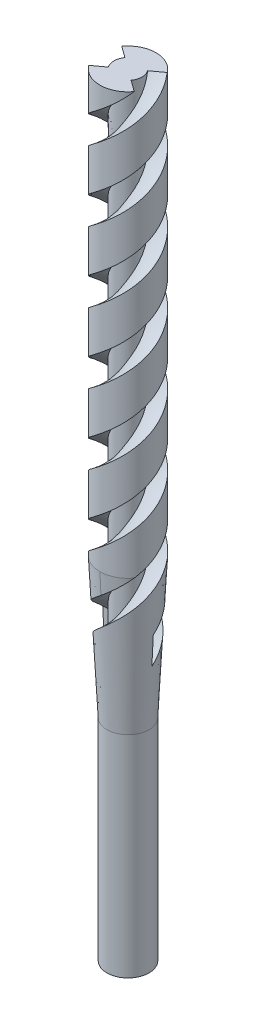
from build123d import *

# Parameters (mm, degrees)
CUT_SWEEP1_PITCH = 20
CUT_SWEEP2_PITCH = 20


with BuildPart() as part:
    # Sketch1 → Revolve1 (revolve)
    with BuildSketch(Plane.XY, mode=Mode.PRIVATE) as revolve1_sk:
        Polygon((0, 332.499538991), (4, 332.499538991), (4, 272.499538991), (3, 252.499538991), (3, 222.499538991), (0, 222.499538991), align=None)
    revolve(revolve1_sk.sketch.rotate(Axis((0, 0, 0), (0, -1, 0)), 90), axis=Axis((0, 0, 0), (0, -1, 0)))

    # Cut-Sweep1: arcs per turn and ends read off the stored shape
    # Cut-Sweep1: the profile of Sketch4 screwed along a right-hand helix through 4.5 turns, 20 arcs to a turn; built about Z, then put on its axis
    cut_sweep1_z = Axis((0, 0, 0), (0, 0, 1))
    cut_sweep1_corners = [(2, 0, -22), (6, 0, -22), (6, 0, -18), (2, 0, -18)]
    with BuildLine(mode=Mode.PRIVATE) as cut_sweep1_profile:
        Line(cut_sweep1_corners[0], cut_sweep1_corners[1])
        Line(cut_sweep1_corners[1], cut_sweep1_corners[2])
        Line(cut_sweep1_corners[2], cut_sweep1_corners[3])
        Line(cut_sweep1_corners[3], cut_sweep1_corners[0])
    cut_sweep1_cap = Face(cut_sweep1_profile.wire())
    cut_sweep1_turn_angles = [0, 9, 18, 27, 36, 45, 54, 63, 72, 81, 90, 99, 108, 117, 126, 135, 144, 153, 162, 171, 180, 189, 198, 207, 216, 225, 234, 243, 252, 261, 270, 279, 288, 297, 306, 315, 324, 333, 342, 351, 360]
    cut_sweep1_turn_weights = [1, 0.9876883405951378, 1, 0.9876883405951378, 1, 0.9876883405951378, 1, 0.9876883405951378, 1, 0.9876883405951378, 1, 0.9876883405951378, 1, 0.9876883405951378, 1, 0.9876883405951378, 1, 0.9876883405951378, 1, 0.9876883405951378, 1, 0.9876883405951378, 1, 0.9876883405951378, 1, 0.9876883405951378, 1, 0.9876883405951378, 1, 0.9876883405951378, 1, 0.9876883405951378, 1, 0.9876883405951378, 1, 0.9876883405951378, 1, 0.9876883405951378, 1, 0.9876883405951378, 1]
    cut_sweep1_turn_rails = [Edge.make_bspline([Vector(p[0], p[1], 0).rotate(cut_sweep1_z, cut_sweep1_turn_angles[k]) / cut_sweep1_turn_weights[k] + Vector(0, 0, p[2] + CUT_SWEEP1_PITCH * cut_sweep1_turn_angles[k] / 360) for k in range(41)], [0, 0, 0, 1, 1, 2, 2, 3, 3, 4, 4, 5, 5, 6, 6, 7, 7, 8, 8, 9, 9, 10, 10, 11, 11, 12, 12, 13, 13, 14, 14, 15, 15, 16, 16, 17, 17, 18, 18, 19, 19, 20, 20, 20], 2, cut_sweep1_turn_weights) for p in cut_sweep1_corners]
    cut_sweep1_turn_sides = [Face.make_surface_from_curves(cut_sweep1_turn_rails[p[0]], cut_sweep1_turn_rails[p[1]]) for p in [(0, 1), (1, 2), (2, 3), (3, 0)]]
    cut_sweep1_last_angles = [1440, 1449, 1458, 1467, 1476, 1485, 1494, 1503, 1512, 1521, 1530, 1539, 1548, 1557, 1566, 1575, 1584, 1593, 1602, 1611, 1620]
    cut_sweep1_last_weights = [1, 0.9876883405951378, 1, 0.9876883405951378, 1, 0.9876883405951378, 1, 0.9876883405951378, 1, 0.9876883405951378, 1, 0.9876883405951378, 1, 0.9876883405951378, 1, 0.9876883405951378, 1, 0.9876883405951378, 1, 0.9876883405951378, 1]
    cut_sweep1_last_rails = [Edge.make_bspline([Vector(p[0], p[1], 0).rotate(cut_sweep1_z, cut_sweep1_last_angles[k]) / cut_sweep1_last_weights[k] + Vector(0, 0, p[2] + CUT_SWEEP1_PITCH * cut_sweep1_last_angles[k] / 360) for k in range(21)], [0, 0, 0, 1, 1, 2, 2, 3, 3, 4, 4, 5, 5, 6, 6, 7, 7, 8, 8, 9, 9, 10, 10, 10], 2, cut_sweep1_last_weights) for p in cut_sweep1_corners]
    cut_sweep1_last_sides = [Face.make_surface_from_curves(cut_sweep1_last_rails[p[0]], cut_sweep1_last_rails[p[1]]) for p in [(0, 1), (1, 2), (2, 3), (3, 0)]]
    cut_sweep1 = Plane(origin=(0, 332.499538991, 0), x_dir=(-1, 0, 0), z_dir=(0, -1, 0)) * Solid(Shell([*[p.moved(Location((0, 0, CUT_SWEEP1_PITCH * i))) for i in range(4) for p in cut_sweep1_turn_sides], *cut_sweep1_last_sides, cut_sweep1_cap, cut_sweep1_cap.rotate(cut_sweep1_z, 1620).moved(Location((0, 0, CUT_SWEEP1_PITCH * 1620 / 360)))]))
    add(cut_sweep1, mode=Mode.SUBTRACT)

    # Cut-Sweep2: arcs per turn and ends read off the stored shape
    # Cut-Sweep2: the profile of Sketch6 screwed along a right-hand helix through 4.5 turns, 20 arcs to a turn; built about Z, then put on its axis
    cut_sweep2_z = Axis((0, 0, 0), (0, 0, 1))
    cut_sweep2_corners = [(2, 0, -22), (6, 0, -22), (6, 0, -18), (2, 0, -18)]
    with BuildLine(mode=Mode.PRIVATE) as cut_sweep2_profile:
        Line(cut_sweep2_corners[0], cut_sweep2_corners[1])
        Line(cut_sweep2_corners[1], cut_sweep2_corners[2])
        Line(cut_sweep2_corners[2], cut_sweep2_corners[3])
        Line(cut_sweep2_corners[3], cut_sweep2_corners[0])
    cut_sweep2_cap = Face(cut_sweep2_profile.wire())
    cut_sweep2_turn_angles = [0, 9, 18, 27, 36, 45, 54, 63, 72, 81, 90, 99, 108, 117, 126, 135, 144, 153, 162, 171, 180, 189, 198, 207, 216, 225, 234, 243, 252, 261, 270, 279, 288, 297, 306, 315, 324, 333, 342, 351, 360]
    cut_sweep2_turn_weights = [1, 0.9876883405951378, 1, 0.9876883405951378, 1, 0.9876883405951378, 1, 0.9876883405951378, 1, 0.9876883405951378, 1, 0.9876883405951378, 1, 0.9876883405951378, 1, 0.9876883405951378, 1, 0.9876883405951378, 1, 0.9876883405951378, 1, 0.9876883405951378, 1, 0.9876883405951378, 1, 0.9876883405951378, 1, 0.9876883405951378, 1, 0.9876883405951378, 1, 0.9876883405951378, 1, 0.9876883405951378, 1, 0.9876883405951378, 1, 0.9876883405951378, 1, 0.9876883405951378, 1]
    cut_sweep2_turn_rails = [Edge.make_bspline([Vector(p[0], p[1], 0).rotate(cut_sweep2_z, cut_sweep2_turn_angles[k]) / cut_sweep2_turn_weights[k] + Vector(0, 0, p[2] + CUT_SWEEP2_PITCH * cut_sweep2_turn_angles[k] / 360) for k in range(41)], [0, 0, 0, 1, 1, 2, 2, 3, 3, 4, 4, 5, 5, 6, 6, 7, 7, 8, 8, 9, 9, 10, 10, 11, 11, 12, 12, 13, 13, 14, 14, 15, 15, 16, 16, 17, 17, 18, 18, 19, 19, 20, 20, 20], 2, cut_sweep2_turn_weights) for p in cut_sweep2_corners]
    cut_sweep2_turn_sides = [Face.make_surface_from_curves(cut_sweep2_turn_rails[p[0]], cut_sweep2_turn_rails[p[1]]) for p in [(0, 1), (1, 2), (2, 3), (3, 0)]]
    cut_sweep2_last_angles = [1440, 1449, 1458, 1467, 1476, 1485, 1494, 1503, 1512, 1521, 1530, 1539, 1548, 1557, 1566, 1575, 1584, 1593, 1602, 1611, 1620]
    cut_sweep2_last_weights = [1, 0.9876883405951378, 1, 0.9876883405951378, 1, 0.9876883405951378, 1, 0.9876883405951378, 1, 0.9876883405951378, 1, 0.9876883405951378, 1, 0.9876883405951378, 1, 0.9876883405951378, 1, 0.9876883405951378, 1, 0.9876883405951378, 1]
    cut_sweep2_last_rails = [Edge.make_bspline([Vector(p[0], p[1], 0).rotate(cut_sweep2_z, cut_sweep2_last_angles[k]) / cut_sweep2_last_weights[k] + Vector(0, 0, p[2] + CUT_SWEEP2_PITCH * cut_sweep2_last_angles[k] / 360) for k in range(21)], [0, 0, 0, 1, 1, 2, 2, 3, 3, 4, 4, 5, 5, 6, 6, 7, 7, 8, 8, 9, 9, 10, 10, 10], 2, cut_sweep2_last_weights) for p in cut_sweep2_corners]
    cut_sweep2_last_sides = [Face.make_surface_from_curves(cut_sweep2_last_rails[p[0]], cut_sweep2_last_rails[p[1]]) for p in [(0, 1), (1, 2), (2, 3), (3, 0)]]
    cut_sweep2 = Plane(origin=(0, 332.499538991, 0), x_dir=(1, 0, 0), z_dir=(0, -1, 0)) * Solid(Shell([*[p.moved(Location((0, 0, CUT_SWEEP2_PITCH * i))) for i in range(4) for p in cut_sweep2_turn_sides], *cut_sweep2_last_sides, cut_sweep2_cap, cut_sweep2_cap.rotate(cut_sweep2_z, 1620).moved(Location((0, 0, CUT_SWEEP2_PITCH * 1620 / 360)))]))
    add(cut_sweep2, mode=Mode.SUBTRACT)


solid = part.part
